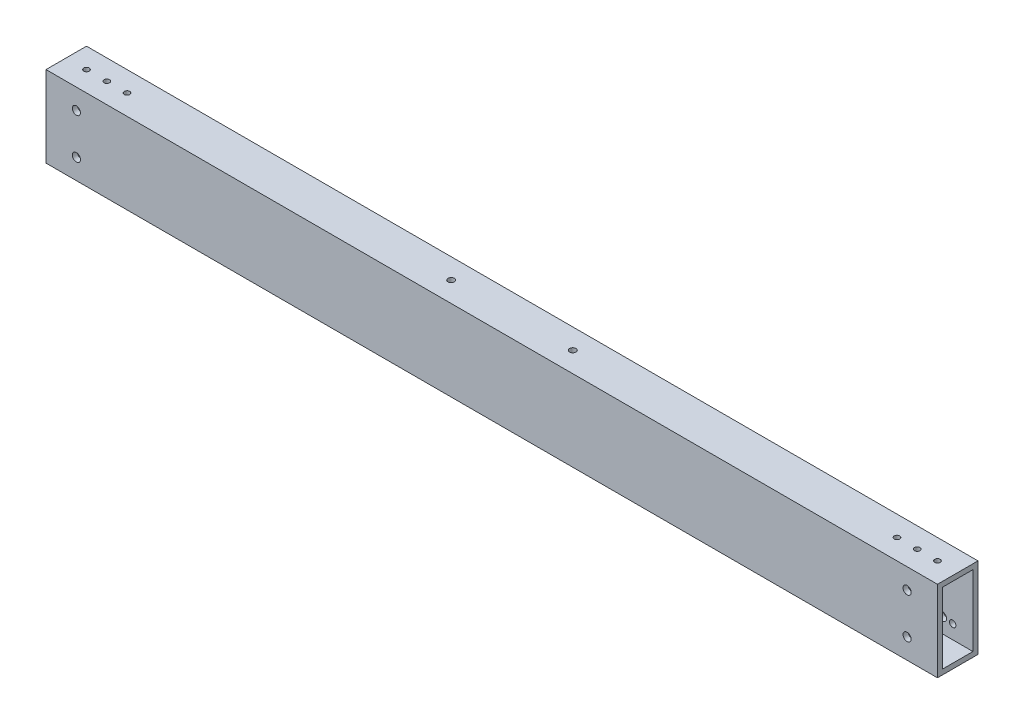
from build123d import *

# Parameters (mm, degrees)
SKETCH1_W                       = 558.8
SKETCH1_H                       = 50.8
BOSS_EXTRUDE1_DEPTH             = 12.7
SKETCH2_W                       = 19.05
SKETCH2_H                       = 44.45
CUT_EXTRUDE1_DEPTH              = 560.521125607
SKETCH4_R                       = 1.7272
CUT_EXTRUDE2_DEPTH              = 6.35
F_1_4_20_TAPPED_HOLE1_D         = 5.1054
F_10_32_TAPPED_HOLE1_D          = 4.0386
F_10_32_TAPPED_HOLE1_DEPTH      = 5.08
F_10_32_TAPPED_HOLE1_TIP        = 1.213317848
F_5_32_0_15625_DIAMETER_HOLE1_D = 3.96875


with BuildPart() as part:
    # Sketch1 → Boss-Extrude1 (new, symmetric)
    with BuildSketch(Plane.XY):
        Rectangle(SKETCH1_W, SKETCH1_H)
    extrude(amount=BOSS_EXTRUDE1_DEPTH, both=True)

    # Sketch2 → Cut-Extrude1 (cut, through all)
    with BuildSketch(Plane(origin=(279.4, 0, 0), x_dir=(0, 0, -1), z_dir=(1, 0, 0))):
        Rectangle(SKETCH2_W, SKETCH2_H)
    extrude(amount=-CUT_EXTRUDE1_DEPTH, mode=Mode.SUBTRACT)

    # Sketch4 → Cut-Extrude2 (cut)
    with BuildSketch(Plane(origin=(0, 25.4, 0), x_dir=(1, 0, 0), z_dir=(0, 1, 0))):
        with Locations((-304.8, 0)):
            Circle(SKETCH4_R)
        with Locations((-292.1, 0)):
            Circle(SKETCH4_R)
        with Locations((-266.7, 0)):
            Circle(SKETCH4_R)
        with Locations((-254, 0)):
            Circle(SKETCH4_R)
        with Locations((-241.3, 0)):
            Circle(SKETCH4_R)
        with Locations((241.3, 0)):
            Circle(SKETCH4_R)
        with Locations((254, 0)):
            Circle(SKETCH4_R)
        with Locations((266.7, 0)):
            Circle(SKETCH4_R)
    extrude(amount=-CUT_EXTRUDE2_DEPTH, mode=Mode.SUBTRACT)

    # 1/4-20 Tapped Hole1 (through all)
    with Locations(Plane.XY.offset(12.7)):
        with Locations((-260.35, 12.7), (-260.35, -12.7), (260.35, 12.7), (260.35, -12.7)):
            Hole(F_1_4_20_TAPPED_HOLE1_D / 2)

    # #10-32 Tapped Hole1
    with Locations(Plane(origin=(0, 0, -12.7), x_dir=(-1, 0, 0), z_dir=(0, 0, -1))):
        with Locations((-266.7, -13.49375), (-190.5, -13.49375), (-114.3, -13.49375), (-38.1, -13.49375), (38.1, -13.49375), (114.3, -13.49375), (190.5, -13.49375), (266.7, -13.49375)):
            Hole(F_10_32_TAPPED_HOLE1_D / 2, depth=F_10_32_TAPPED_HOLE1_DEPTH)
            with Locations((0, 0, -(F_10_32_TAPPED_HOLE1_DEPTH + F_10_32_TAPPED_HOLE1_TIP / 2))):  # 118° drill point
                Cone(0, F_10_32_TAPPED_HOLE1_D / 2, F_10_32_TAPPED_HOLE1_TIP, mode=Mode.SUBTRACT)

    # 5/32 (0.15625) Diameter Hole1 (through all)
    with Locations(Plane(origin=(0, 25.4, 0), x_dir=(1, 0, 0), z_dir=(0, 1, 0))):
        with Locations((-38.1, 0), (38.1, 0)):
            Hole(F_5_32_0_15625_DIAMETER_HOLE1_D / 2)


solid = part.part
